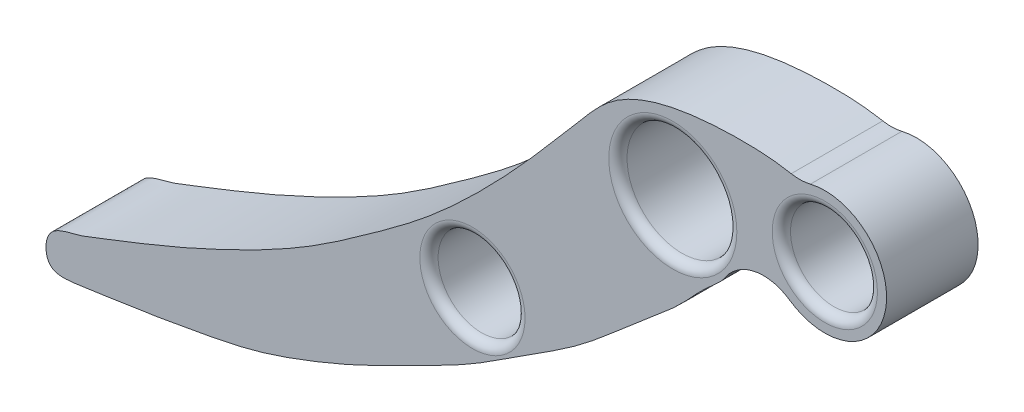
from build123d import *

# Parameters (mm, degrees)
SKETCH5_R           = 3.8
SKETCH5_R_2         = 4.8
BOSS_EXTRUDE2_DEPTH = 4
FILLET1_START       = -4
FILLET1_DEPTH       = 8
FILLET2_R           = 4
FILLET3_R           = 0.8


with BuildPart() as part:
    # Sketch5 → Boss-Extrude2 (new, symmetric)
    with BuildSketch(Plane.XY):
        with BuildLine():
            ThreePointArc((8.714070291, -1.265403979), (18.427065595, -0.069323442), (11.272572376, 6.607959928))
            add(Edge.make_bspline(
                [(11.272572376, 6.607959928), (9.170884822, 7.12975008), (5.689501513, 7.253061402), (0.025506718, 6.828297892), (-4.91113051, 5.373608296), (-8.001797221, 1.721428877), (-10.677143119, -1.448665814), (-13.619449743, -4.807125196), (-17.443738565, -8.797511933), (-21.541471608, -12.572417953), (-26.611568287, -16.282432157), (-31.767981819, -19.914357381), (-37.874325875, -23.164873095), (-44.29001854, -26.0818145), (-48.703533755, -27.757049093), (-52.456040122, -29.25250184), (-54.895066579, -29.458745871), (-54.875292932, -33.18915407), (-50.829704098, -32.605168513), (-45.808201518, -31.891771918), (-41.853007229, -31.189067982), (-36.835992107, -30.230568054), (-32.333434845, -28.693176316), (-27.520953103, -26.711967064), (-22.592090566, -24.175612645), (-17.702247494, -21.778025806), (-12.976785829, -18.571527191), (-8.50635045, -15.849657043), (-4.794446832, -12.648959892), (-1.921958122, -10.172412423), (0.774409868, -7.955622136), (2.537202012, -5.81374013), (4.61350822, -4.224098296), (5.390532291, -2.385093762), (7.045265364, -1.472105098), (8.095405493, -1.279985414), (8.714070291, -1.265403979)],
                knots=[0.024242531, 0.024242531, 0.024242531, 0.024242531, 0.064900502, 0.088400363, 0.131422169, 0.155558546, 0.176507873, 0.209387061, 0.239014533, 0.280012715, 0.313443892, 0.356616381, 0.397784949, 0.443365379, 0.485923752, 0.492844269, 0.512570542, 0.525807518, 0.542884708, 0.574177107, 0.610427481, 0.636920677, 0.666470325, 0.700946017, 0.734598709, 0.771031933, 0.803376592, 0.842135533, 0.869451652, 0.895551684, 0.913715434, 0.935059418, 0.947634121, 0.962394457, 0.970576348, 0.982138893, 0.982138893, 0.982138893, 0.982138893], degree=3))
        make_face()
        with Locations((13.291416209, 1.59954006)):
            Circle(SKETCH5_R, mode=Mode.SUBTRACT)
        Circle(SKETCH5_R_2, mode=Mode.SUBTRACT)
        with Locations((-17.514703063, -15.775516467)):
            Circle(SKETCH5_R, mode=Mode.SUBTRACT)
    extrude(amount=BOSS_EXTRUDE2_DEPTH, both=True)

    # Fillet1: read off the stored shape, not the designer's step
    # Fillet1 outline → Fillet1 (add)
    with BuildSketch(Plane.XY.offset(FILLET1_START)):
        with BuildLine():
            add(Edge.make_bspline(
                [(4.631536112, -3.869418889), (5.002620064, -3.325943543), (5.508011121, -2.320275549), (7.045265364, -1.472105098), (8.095405493, -1.279985414), (8.714070291, -1.265403979)],
                knots=[0.950083809, 0.950083809, 0.950083809, 0.950083809, 0.962394457, 0.970576348, 0.982138893, 0.982138893, 0.982138893, 0.982138893], degree=3))
            ThreePointArc((4.631536112, -3.869418889), (7.208196953, -2.191548618), (10.21429044, -2.83794763))
            ThreePointArc((10.21429044, -2.83794763), (9.384248746, -2.127931256), (8.714070291, -1.265403979))
        make_face()
    extrude(amount=FILLET1_DEPTH)

    # Fillet2
    fillet2_edges = [part.edges().sort_by_distance(p)[0] for p in [
        (11.272572376, 6.607959928, 2),
    ]]
    fillet(fillet2_edges, radius=FILLET2_R)

    # Fillet3
    fillet3_edges = [part.edges().sort_by_distance(p)[0] for p in [
        (-21.314703063, -15.775516467, 4),
        (9.491416209, 1.59954006, 4),
        (9.491416209, 1.59954006, -4),
        (-4.8, 0, 4),
        (-21.314703063, -15.775516467, -4),
        (-4.8, 0, -4),
    ]]
    fillet(fillet3_edges, radius=FILLET3_R)


solid = part.part
